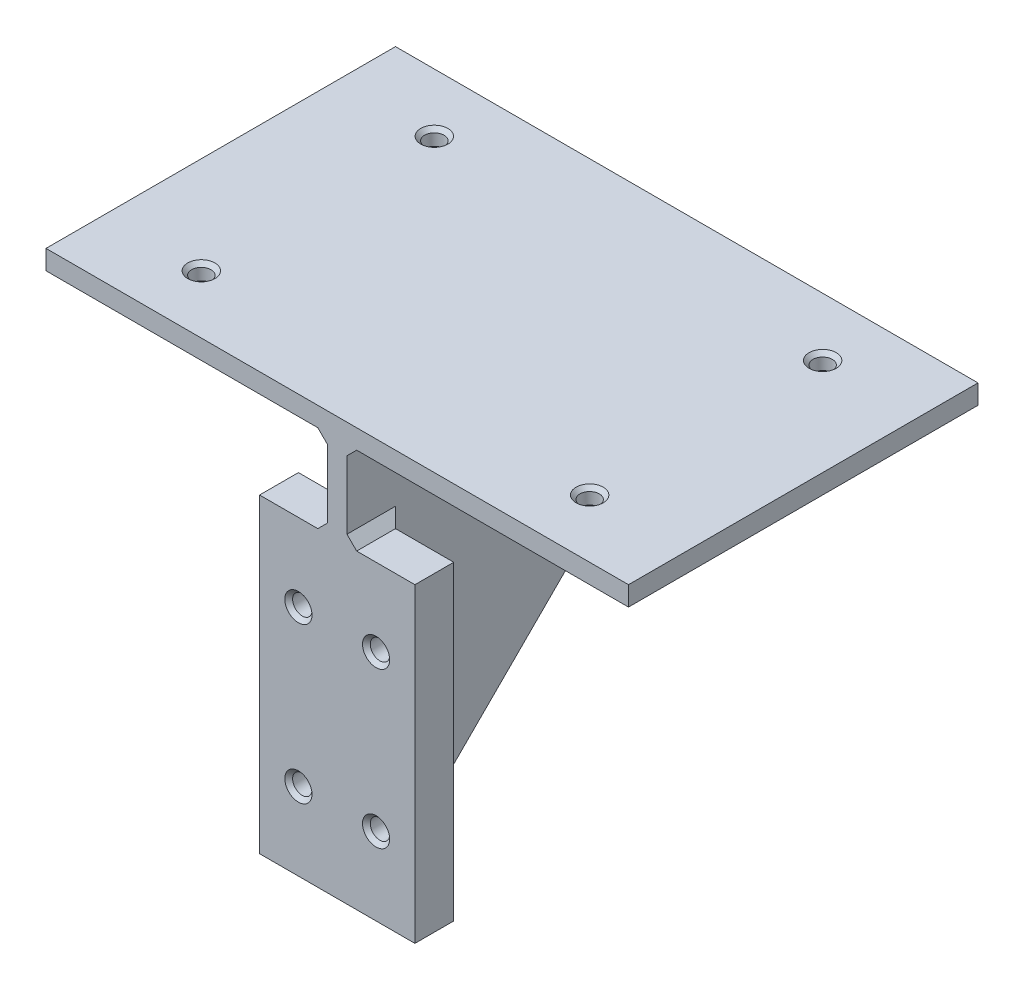
from build123d import *

# Parameters (mm, degrees)
SKETCH1_W           = 40
SKETCH1_H           = 80
BOSS_EXTRUDE1_DEPTH = 10
SKETCH2_R           = 2.5
CUT_EXTRUDE1_DEPTH  = 10
BOSS_EXTRUDE2_DEPTH = 2.5
SKETCH4_W           = 150
SKETCH4_H           = 90
BOSS_EXTRUDE3_DEPTH = 2.5
CHAMFER1_SIZE       = 2.5
SKETCH5_R           = 2.5
CUT_EXTRUDE2_DEPTH  = 35
CHAMFER2_SIZE       = 1


with BuildPart() as part:
    # Sketch1 → Boss-Extrude1 (new body)
    with BuildSketch(Plane.XY):
        Rectangle(SKETCH1_W, SKETCH1_H)
    extrude(amount=BOSS_EXTRUDE1_DEPTH)

    # Sketch2 → Cut-Extrude1 (cut)
    with BuildSketch(Plane.XY.offset(10)):
        with Locations((-10, -20)):
            Circle(SKETCH2_R)
        with Locations(Location((10, -20, 0), (0, 0, 180))):
            Circle(SKETCH2_R)
        with Locations((10, 20)):
            Circle(SKETCH2_R)
        with Locations(Location((-10, 20, 0), (0, 0, 180))):
            Circle(SKETCH2_R)
    extrude(amount=-CUT_EXTRUDE1_DEPTH, mode=Mode.SUBTRACT)

    # Sketch3 → Boss-Extrude2 (add, symmetric)
    with BuildSketch(Plane(origin=(0, 0, 0), x_dir=(0, 0, -1), z_dir=(1, 0, 0))):
        Polygon((0, -40), (80, 40), (80, 65), (-10, 65), (-10, 40), (0, 40), align=None)
    extrude(amount=BOSS_EXTRUDE2_DEPTH, both=True)

    # Sketch4 → Boss-Extrude3 (add, symmetric)
    with BuildSketch(Plane(origin=(0, 65, 0), x_dir=(1, 0, 0), z_dir=(0, 1, 0))):
        with Locations((0, 35)):
            Rectangle(SKETCH4_W, SKETCH4_H)
    extrude(amount=BOSS_EXTRUDE3_DEPTH, both=True)

    # Chamfer1
    # the kernel refuses this chamfer: 2.5 mm, written as the material it adds along each edge
    with BuildSketch(Plane(origin=(-2.5, 40, 0), x_dir=(-0.9996219169112968, 0, 0.027495876610586372), z_dir=(0, -1, 0))) as chamfer1_piece_1_section:
        Polygon((CHAMFER1_SIZE * 0.999621916911, CHAMFER1_SIZE * 0.0274958766106), (-CHAMFER1_SIZE * 0.0274958766106, CHAMFER1_SIZE * 0.999621916911), (0, 0), align=None)
    chamfer1_piece_1 = extrude(amount=80, mode=Mode.PRIVATE)
    chamfer1_piece_1 = split(chamfer1_piece_1, bisect_by=Plane(origin=(-3.327144793, -19.384975846, -20.615024154), z_dir=(0, 0.7071067811865487, 0.7071067811865464)), keep=Keep.TOP, mode=Mode.PRIVATE)
    add(chamfer1_piece_1)
    with BuildSketch(Plane(origin=(-2.5, 40, 10), x_dir=(-0.9996219169112968, -0.0274958766105877, 0), z_dir=(0, 0, -1))) as chamfer1_piece_2:
        Polygon((CHAMFER1_SIZE * 0.999621916911, CHAMFER1_SIZE * 0.0274958766106), (-CHAMFER1_SIZE * 0.0274958766106, CHAMFER1_SIZE * 0.999621916911), (0, 0), align=None)
    extrude(amount=10)
    with BuildSketch(Plane(origin=(2.5, 40, 0), x_dir=(0.9996219169112968, 0, 0.027495876610586372), z_dir=(0, -1, 0))) as chamfer1_piece_3_section:
        Polygon((CHAMFER1_SIZE * 0.999621916911, -CHAMFER1_SIZE * 0.0274958766106), (-CHAMFER1_SIZE * 0.0274958766106, -CHAMFER1_SIZE * 0.999621916911), (0, 0), align=None)
    chamfer1_piece_3 = extrude(amount=80, mode=Mode.PRIVATE)
    chamfer1_piece_3 = split(chamfer1_piece_3, bisect_by=Plane(origin=(3.327144793, -19.384975846, -20.615024154), z_dir=(0, 0.7071067811865487, 0.7071067811865464)), keep=Keep.TOP, mode=Mode.PRIVATE)
    add(chamfer1_piece_3)
    with BuildSketch(Plane(origin=(2.5, 40, 10), x_dir=(0.9996219169112968, -0.0274958766105877, 0), z_dir=(0, 0, -1))) as chamfer1_piece_4:
        Polygon((CHAMFER1_SIZE * 0.999621916911, -CHAMFER1_SIZE * 0.0274958766106), (-CHAMFER1_SIZE * 0.0274958766106, -CHAMFER1_SIZE * 0.999621916911), (0, 0), align=None)
    extrude(amount=10)
    with BuildSketch(Plane(origin=(-2.5, 62.5, -80), x_dir=(0.027495876610586282, -0.9996219169112968, 0), z_dir=(0, 0, 1))) as chamfer1_piece_5:
        Polygon((CHAMFER1_SIZE * 0.999621916911, -CHAMFER1_SIZE * 0.0274958766106), (-CHAMFER1_SIZE * 0.0274958766106, -CHAMFER1_SIZE * 0.999621916911), (0, 0), align=None)
    extrude(amount=90)
    with BuildSketch(Plane(origin=(2.5, 62.5, -80), x_dir=(-0.027495876610586282, -0.9996219169112968, 0), z_dir=(0, 0, 1))) as chamfer1_piece_6:
        Polygon((CHAMFER1_SIZE * 0.999621916911, CHAMFER1_SIZE * 0.0274958766106), (-CHAMFER1_SIZE * 0.0274958766106, CHAMFER1_SIZE * 0.999621916911), (0, 0), align=None)
    extrude(amount=90)
    with BuildSketch(Plane(origin=(-2.5, 46.42920747, 0), x_dir=(-0.9996219169112968, 0, 0.027495876610586372), z_dir=(0, -1, 0))) as chamfer1_piece_7a_section:
        Polygon((CHAMFER1_SIZE * 0.999621916911, CHAMFER1_SIZE * 0.0274958766106), (-CHAMFER1_SIZE * 0.0274958766106, CHAMFER1_SIZE * 0.999621916911), (0, 0), align=None)
    chamfer1_piece_7a = extrude(amount=86.42920747, mode=Mode.PRIVATE)
    chamfer1_piece_7a = split(chamfer1_piece_7a, bisect_by=Plane(origin=(-3.324484067, 40, -0.824484067), z_dir=(0, 1, 0)), keep=Keep.TOP, mode=Mode.PRIVATE)
    with BuildSketch(Plane(origin=(-2.5, 40, 10), x_dir=(-0.9996219169112968, -0.0274958766105877, 0), z_dir=(0, 0, -1))) as chamfer1_piece_7b_section:
        Polygon((CHAMFER1_SIZE * 0.999621916911, CHAMFER1_SIZE * 0.0274958766106), (-CHAMFER1_SIZE * 0.0274958766106, CHAMFER1_SIZE * 0.999621916911), (0, 0), align=None)
    chamfer1_piece_7b = extrude(amount=16.42920747, mode=Mode.PRIVATE)
    chamfer1_piece_7b = split(chamfer1_piece_7b, bisect_by=Plane(origin=(-3.324484067, 40.824484067, 0), z_dir=(0, 0, -1)), keep=Keep.TOP, mode=Mode.PRIVATE)
    chamfer1_piece_7 = chamfer1_piece_7a & chamfer1_piece_7b
    add(chamfer1_piece_7)
    with BuildSketch(Plane(origin=(2.5, 46.42920747, 0), x_dir=(0.9996219169112968, 0, 0.027495876610586372), z_dir=(0, -1, 0))) as chamfer1_piece_8a_section:
        Polygon((CHAMFER1_SIZE * 0.999621916911, -CHAMFER1_SIZE * 0.0274958766106), (-CHAMFER1_SIZE * 0.0274958766106, -CHAMFER1_SIZE * 0.999621916911), (0, 0), align=None)
    chamfer1_piece_8a = extrude(amount=86.42920747, mode=Mode.PRIVATE)
    chamfer1_piece_8a = split(chamfer1_piece_8a, bisect_by=Plane(origin=(3.324484067, 40, -0.824484067), z_dir=(0, 1, 0)), keep=Keep.TOP, mode=Mode.PRIVATE)
    with BuildSketch(Plane(origin=(2.5, 40, 10), x_dir=(0.9996219169112968, -0.0274958766105877, 0), z_dir=(0, 0, -1))) as chamfer1_piece_8b_section:
        Polygon((CHAMFER1_SIZE * 0.999621916911, -CHAMFER1_SIZE * 0.0274958766106), (-CHAMFER1_SIZE * 0.0274958766106, -CHAMFER1_SIZE * 0.999621916911), (0, 0), align=None)
    chamfer1_piece_8b = extrude(amount=16.42920747, mode=Mode.PRIVATE)
    chamfer1_piece_8b = split(chamfer1_piece_8b, bisect_by=Plane(origin=(3.324484067, 40.824484067, 0), z_dir=(0, 0, -1)), keep=Keep.TOP, mode=Mode.PRIVATE)
    chamfer1_piece_8 = chamfer1_piece_8a & chamfer1_piece_8b
    add(chamfer1_piece_8)

    # Sketch5 → Cut-Extrude2 (cut, symmetric)
    with BuildSketch(Plane(origin=(0, 67.5, 0), x_dir=(1, 0, 0), z_dir=(0, 1, 0))):
        with Locations(Location((50, 65, 0), (0, 0, 90))):
            Circle(SKETCH5_R)
        with Locations(Location((50, 5, 0), (0, 0, 90))):
            Circle(SKETCH5_R)
        with Locations(Location((-50, 5, 0), (0, 0, 90))):
            Circle(SKETCH5_R)
        with Locations(Location((-50, 65, 0), (0, 0, 90))):
            Circle(SKETCH5_R)
    extrude(amount=CUT_EXTRUDE2_DEPTH, both=True, mode=Mode.SUBTRACT)

    # Chamfer2
    chamfer2_edges = [part.edges().sort_by_distance(p)[0] for p in [
        (-50, 62.5, -62.5),
        (-50, 67.5, -62.5),
        (-50, 62.5, -2.5),
        (-50, 67.5, -2.5),
        (50, 67.5, -2.5),
        (50, 62.5, -2.5),
        (50, 67.5, -62.5),
        (50, 62.5, -62.5),
        (-7.5, 20, 0),
        (-7.5, 20, 10),
        (7.5, 20, 0),
        (7.5, 20, 10),
        (12.5, -20, 0),
        (12.5, -20, 10),
        (-12.5, -20, 0),
        (-12.5, -20, 10),
    ]]
    chamfer(chamfer2_edges, length=CHAMFER2_SIZE)


solid = part.part
